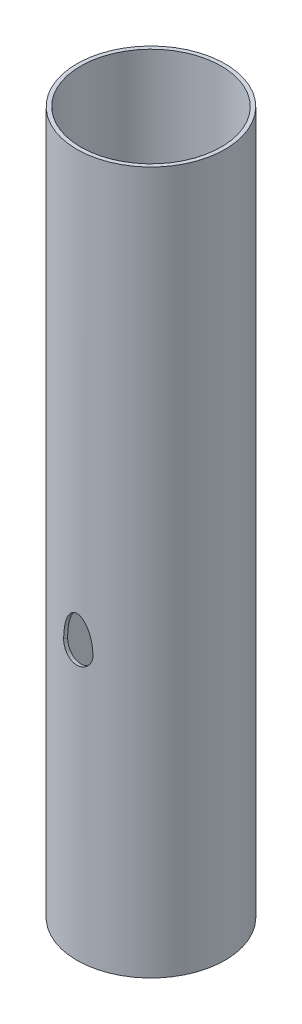
from build123d import *

# Parameters (mm, degrees)
SKETCH2_R           = 38
SKETCH2_R_2         = 36
BOSS_EXTRUDE1_DEPTH = 360
CUT_EXTRUDE1_REACH  = 365.989


with BuildPart() as part:
    # Sketch2 → Boss-Extrude1 (new body)
    with BuildSketch(Plane(origin=(0, 0, 0), x_dir=(1, 0, 0), z_dir=(0, 1, 0))):
        Circle(SKETCH2_R)
        Circle(SKETCH2_R_2, mode=Mode.SUBTRACT)
    extrude(amount=BOSS_EXTRUDE1_DEPTH)

    # Sketch3 → Cut-Extrude1 (cut, up to next)
    with BuildSketch(Plane(origin=(0, 0, 0), x_dir=(-1, 0, 0), z_dir=(0, 0.20449605184179045, 0.978867388761685)), mode=Mode.PRIVATE) as cut_extrude1_sk1:
        with BuildLine():
            ThreePointArc((7.5, -128), (0, -120.5), (-7.5, -128))
            add(Edge.make_bspline(
                [(-7.5, -128), (-7.5, -143), (0, -143), (7.5, -143), (7.5, -128)],
                knots=[4.71238898, 4.71238898, 4.71238898, 6.283185307, 6.283185307, 7.853981634, 7.853981634, 7.853981634], degree=2, weights=[1, 0.707106781, 1, 0.707106781, 1]))
        make_face()
    cut_extrude1_tool1 = extrude(cut_extrude1_sk1.sketch, amount=CUT_EXTRUDE1_REACH, mode=Mode.PRIVATE) & part.part
    add(cut_extrude1_tool1.solids().sort_by_distance((0, 128.409741, -26.826193))[0], mode=Mode.SUBTRACT)


solid = part.part
